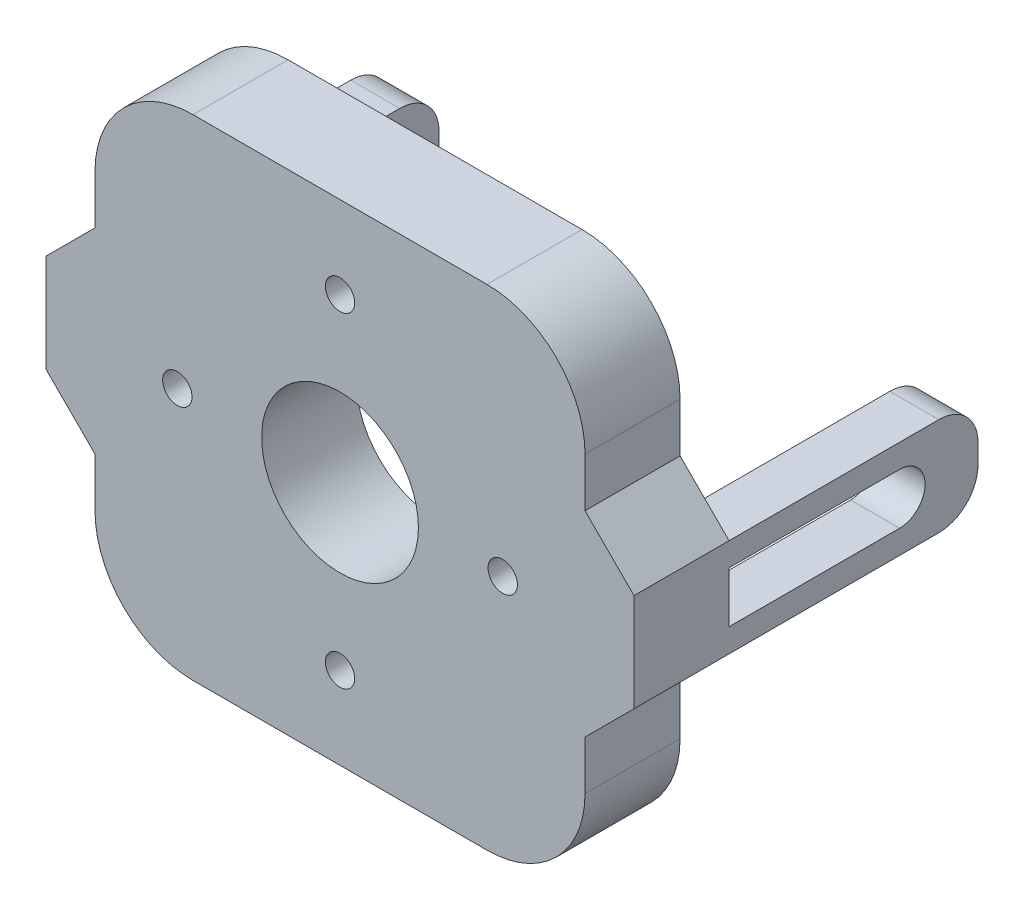
from build123d import *

# Parameters (mm, degrees)
SKETCH1_W           = 50
SKETCH1_H           = 50
SKETCH1_R           = 8
SKETCH1_R_2         = 1.5
BOSS_EXTRUDE1_DEPTH = 9.7
FILLET2_R           = 10
BOSS_EXTRUDE3_DEPTH = 5
CIRPATTERN6_COUNT   = 2
CUT_EXTRUDE1_DEPTH  = 2.5
FILLET3_R           = 4
CHAMFER2_SIZE       = 5


with BuildPart() as part:
    # Sketch1 → Boss-Extrude1 (new body)
    with BuildSketch(Plane.XY):
        Rectangle(SKETCH1_W, SKETCH1_H)
        Circle(SKETCH1_R, mode=Mode.SUBTRACT)
        with Locations((16.6, 0)):
            Circle(SKETCH1_R_2, mode=Mode.SUBTRACT)
        with Locations((0, -16.6)):
            Circle(SKETCH1_R_2, mode=Mode.SUBTRACT)
        with Locations((-16.6, 0)):
            Circle(SKETCH1_R_2, mode=Mode.SUBTRACT)
        with Locations((0, 16.6)):
            Circle(SKETCH1_R_2, mode=Mode.SUBTRACT)
    extrude(amount=BOSS_EXTRUDE1_DEPTH)

    # Fillet2
    fillet2_edges = [part.edges().sort_by_distance(p)[0] for p in [
        (-25, -25, 4.85),
        (-25, 25, 4.85),
        (25, 25, 4.85),
        (25, -25, 4.85),
    ]]
    fillet(fillet2_edges, radius=FILLET2_R)

    # Sketch7 → Boss-Extrude3 (add)
    with BuildSketch(Plane(origin=(25, 0, 0), x_dir=(0, 0, -1), z_dir=(1, 0, 0))):
        with BuildLine():
            Line((25.4, 5), (0, 5))
            Line((0, 5), (0, 2.6))
            Line((0, 2.6), (17.4, 2.6))
            ThreePointArc((17.4, 2.6), (19.238477631, 1.838477631), (20, 0))
            ThreePointArc((20, 0), (19.238477631, -1.838477631), (17.4, -2.6))
            Line((17.4, -2.6), (0, -2.6))
            Line((0, -2.6), (0, -5))
            Line((0, -5), (25.4, -5))
            Line((25.4, -5), (25.4, 5))
        make_face()
        Polygon((0, 5), (-9.7, 5), (-9.7, -5), (0, -5), (0, -2.6), (0, 2.6), align=None)
    boss_extrude3 = extrude(amount=BOSS_EXTRUDE3_DEPTH)

    # CirPattern6: Boss-Extrude3 ×2 about axis
    cirpattern6_axis = Axis((0, 0, 0), (0, 0, 1))
    for i in range(1, CIRPATTERN6_COUNT):
        add(boss_extrude3.rotate(cirpattern6_axis, i * 360 / CIRPATTERN6_COUNT))

    # Sketch9 → Cut-Extrude1 (cut)
    with BuildSketch(Plane(origin=(0, 0, 0), x_dir=(-1, 0, 0), z_dir=(0, 0, -1))):
        Polygon((2.801592181, -15.132762794), (2.801592181, -18.257762794), (0.095262794, -19.820262794), (-2.611066592, -18.257762794), (-2.611066592, -15.132762794), (0.095262794, -13.570262794), align=None)
        Polygon((18.1625, -2.706329387), (15.0375, -2.706329387), (13.475, 0), (15.0375, 2.706329387), (18.1625, 2.706329387), (19.725, 0), align=None)
        Polygon((2.611066592, 14.942237206), (-0.095262794, 13.379737206), (-2.801592181, 14.942237206), (-2.801592181, 18.067237206), (-0.095262794, 19.629737206), (2.611066592, 18.067237206), align=None)
        Polygon((-13.475, -0.190525589), (-15.0375, -2.896854976), (-18.1625, -2.896854976), (-19.725, -0.190525589), (-18.1625, 2.515803798), (-15.0375, 2.515803798), align=None)
    extrude(amount=-CUT_EXTRUDE1_DEPTH, mode=Mode.SUBTRACT)

    # Fillet3
    fillet3_edges = [part.edges().sort_by_distance(p)[0] for p in [
        (27.5, -5, -25.4),
        (27.5, 5, -25.4),
        (-27.5, 5, -25.4),
        (-27.5, -5, -25.4),
    ]]
    fillet(fillet3_edges, radius=FILLET3_R)

    # Chamfer2
    # the kernel refuses this chamfer: 5 mm, written as the material it adds along each edge
    with BuildSketch(Plane(origin=(-25, 5, 0), x_dir=(-0.9996219169112968, -0.027495876610586147, 0), z_dir=(0, 0, 1)), Plane(origin=(25, 5, 0), x_dir=(-0.027495876610586317, 0.9996219169112968, 0), z_dir=(0, 0, 1))) as chamfer2_piece_1:
        Polygon((CHAMFER2_SIZE * 0.999621916911, -CHAMFER2_SIZE * 0.0274958766106), (-CHAMFER2_SIZE * 0.0274958766106, -CHAMFER2_SIZE * 0.999621916911), (0, 0), align=None)
    extrude(amount=9.7)
    with BuildSketch(Plane(origin=(-25, -5, 0), x_dir=(-0.9996219169112968, 0.02749587661058649, 0), z_dir=(0, 0, 1)), Plane(origin=(25, -5, 0), x_dir=(-0.027495876610586317, -0.9996219169112968, 0), z_dir=(0, 0, 1))) as chamfer2_piece_2:
        Polygon((CHAMFER2_SIZE * 0.999621916911, CHAMFER2_SIZE * 0.0274958766106), (-CHAMFER2_SIZE * 0.0274958766106, CHAMFER2_SIZE * 0.999621916911), (0, 0), align=None)
    extrude(amount=9.7)


solid = part.part
